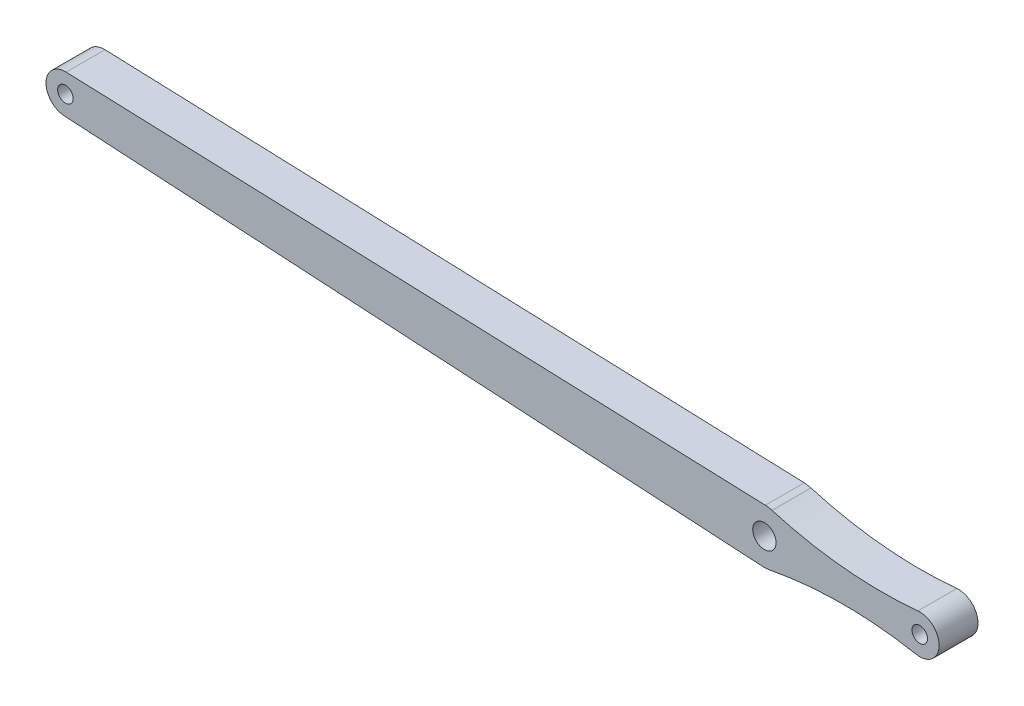
from build123d import *

# Parameters (mm, degrees)
BOSS_EXTRUDE1_DEPTH      = 5
BOSS_EXTRUDE1_DEPTH_BACK = 5
SKETCH1_R                = 3
SKETCH1_R_2              = 2


with BuildPart() as part:
    # Sketch1 → Boss-Extrude1 (new, two sides: drawn at the far end of the back side and taken through both)
    with BuildSketch(Plane.XY.offset(-BOSS_EXTRUDE1_DEPTH_BACK)):
        with BuildLine():
            Line((-182.417557608, 130.069233269), (-2.738129531, 119.519203603))
            ThreePointArc((-2.738129531, 119.519203603), (-1.864332396, 119.522529831), (-0.997757545, 119.634692761))
            ThreePointArc((-0.997757545, 119.634692761), (17.844539234, 121.456345091), (36.692521987, 119.694496281))
            ThreePointArc((36.692521987, 119.694496281), (42.621339195, 124.368801204), (37.163034738, 129.584825788))
            ThreePointArc((37.163034738, 129.584825788), (18.232918148, 129.620194902), (-0.351352176, 133.222341709))
            ThreePointArc((-0.351352176, 133.222341709), (-1.203365677, 133.416263062), (-2.072900839, 133.502524856))
            Line((-2.072900839, 133.502524856), (-181.942394257, 140.057319878))
            ThreePointArc((-181.942394257, 140.057319878), (-187.118834744, 135.298232957), (-182.417557608, 130.069233269))
        make_face()
        with Locations((-2.327825271, 126.507168286)):
            Circle(SKETCH1_R, mode=Mode.SUBTRACT)
        with Locations((-182.124483137, 135.060636614)):
            Circle(SKETCH1_R_2, mode=Mode.SUBTRACT)
        with Locations((37.626987588, 124.606397547)):
            Circle(SKETCH1_R_2, mode=Mode.SUBTRACT)
    extrude(amount=BOSS_EXTRUDE1_DEPTH + BOSS_EXTRUDE1_DEPTH_BACK)


solid = part.part
